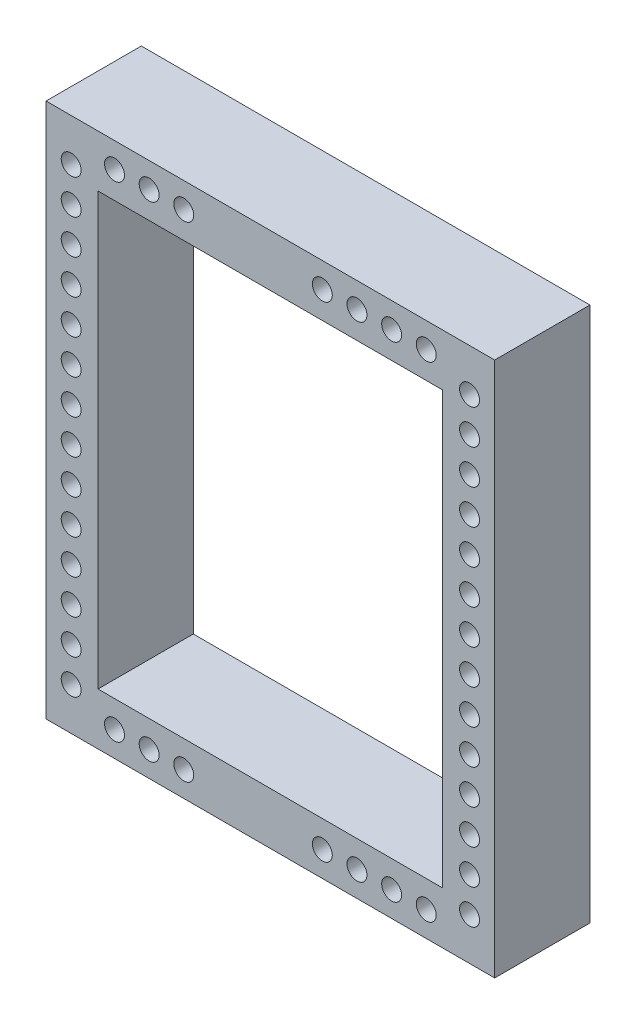
from build123d import *

# Parameters (mm, degrees)
POGO_W              = 25.9
POGO_H              = 30.9
POGO_R              = 0.575
POGO_W_2            = 19.9
POGO_H_2            = 24.9
BOSS_EXTRUDE1_DEPTH = 5.5


with BuildPart() as part:
    # pogo → Boss-Extrude1 (new body)
    with BuildSketch(Plane.XY):
        Rectangle(POGO_W, POGO_H)
        with Locations((-11.5, 13)):
            Circle(POGO_R, mode=Mode.SUBTRACT)
        with Locations((11.5, 13)):
            Circle(POGO_R, mode=Mode.SUBTRACT)
        with Locations((11.5, 11)):
            Circle(POGO_R, mode=Mode.SUBTRACT)
        with Locations((11.5, 9)):
            Circle(POGO_R, mode=Mode.SUBTRACT)
        with Locations((11.5, 7)):
            Circle(POGO_R, mode=Mode.SUBTRACT)
        with Locations((11.5, 5)):
            Circle(POGO_R, mode=Mode.SUBTRACT)
        with Locations((11.5, 3)):
            Circle(POGO_R, mode=Mode.SUBTRACT)
        with Locations((11.5, 1)):
            Circle(POGO_R, mode=Mode.SUBTRACT)
        with Locations((11.5, -1)):
            Circle(POGO_R, mode=Mode.SUBTRACT)
        with Locations((11.5, -3)):
            Circle(POGO_R, mode=Mode.SUBTRACT)
        with Locations((11.5, -5)):
            Circle(POGO_R, mode=Mode.SUBTRACT)
        with Locations((11.5, -7)):
            Circle(POGO_R, mode=Mode.SUBTRACT)
        with Locations((11.5, -9)):
            Circle(POGO_R, mode=Mode.SUBTRACT)
        with Locations((11.5, -11)):
            Circle(POGO_R, mode=Mode.SUBTRACT)
        with Locations((11.5, -13)):
            Circle(POGO_R, mode=Mode.SUBTRACT)
        with Locations((-11.5, 11)):
            Circle(POGO_R, mode=Mode.SUBTRACT)
        with Locations((-11.5, 9)):
            Circle(POGO_R, mode=Mode.SUBTRACT)
        with Locations((-11.5, 7)):
            Circle(POGO_R, mode=Mode.SUBTRACT)
        with Locations((-11.5, 5)):
            Circle(POGO_R, mode=Mode.SUBTRACT)
        with Locations((-11.5, 3)):
            Circle(POGO_R, mode=Mode.SUBTRACT)
        with Locations((-11.5, 1)):
            Circle(POGO_R, mode=Mode.SUBTRACT)
        with Locations((-11.5, -1)):
            Circle(POGO_R, mode=Mode.SUBTRACT)
        with Locations((-11.5, -3)):
            Circle(POGO_R, mode=Mode.SUBTRACT)
        with Locations((-11.5, -5)):
            Circle(POGO_R, mode=Mode.SUBTRACT)
        with Locations((-11.5, -7)):
            Circle(POGO_R, mode=Mode.SUBTRACT)
        with Locations((-11.5, -9)):
            Circle(POGO_R, mode=Mode.SUBTRACT)
        with Locations((-11.5, -11)):
            Circle(POGO_R, mode=Mode.SUBTRACT)
        with Locations((-11.5, -13)):
            Circle(POGO_R, mode=Mode.SUBTRACT)
        with Locations((-9, 14)):
            Circle(POGO_R, mode=Mode.SUBTRACT)
        with Locations((-7, 14)):
            Circle(POGO_R, mode=Mode.SUBTRACT)
        with Locations((-5, 14)):
            Circle(POGO_R, mode=Mode.SUBTRACT)
        with Locations((3, 14)):
            Circle(POGO_R, mode=Mode.SUBTRACT)
        with Locations((5, 14)):
            Circle(POGO_R, mode=Mode.SUBTRACT)
        with Locations((7, 14)):
            Circle(POGO_R, mode=Mode.SUBTRACT)
        with Locations((9, 14)):
            Circle(POGO_R, mode=Mode.SUBTRACT)
        with Locations((-7, -14)):
            Circle(POGO_R, mode=Mode.SUBTRACT)
        with Locations((-5, -14)):
            Circle(POGO_R, mode=Mode.SUBTRACT)
        with Locations((3, -14)):
            Circle(POGO_R, mode=Mode.SUBTRACT)
        with Locations((5, -14)):
            Circle(POGO_R, mode=Mode.SUBTRACT)
        with Locations((7, -14)):
            Circle(POGO_R, mode=Mode.SUBTRACT)
        with Locations((9, -14)):
            Circle(POGO_R, mode=Mode.SUBTRACT)
        with Locations((-9, -14)):
            Circle(POGO_R, mode=Mode.SUBTRACT)
        Rectangle(POGO_W_2, POGO_H_2, mode=Mode.SUBTRACT)
    extrude(amount=BOSS_EXTRUDE1_DEPTH)


solid = part.part
